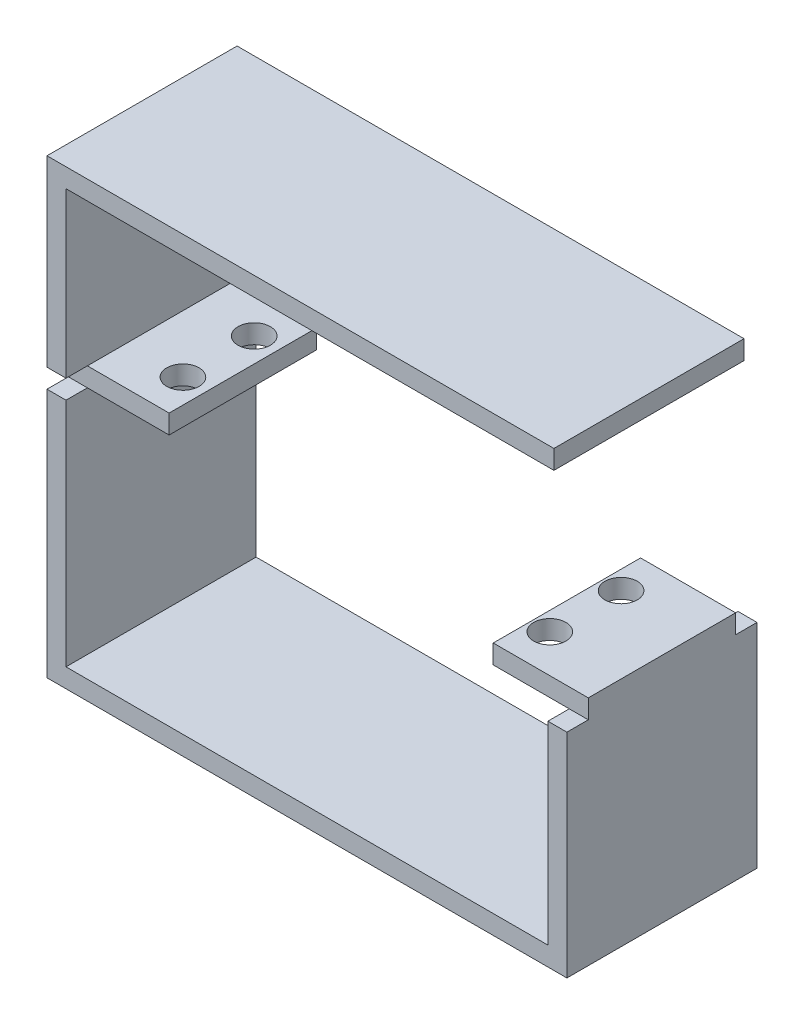
from build123d import *

# Parameters (mm, degrees)
BOSS_EXTRUDE1_OUTLINE_W = 13.462
BOSS_EXTRUDE1_OUTLINE_H = 19.685
BOSS_EXTRUDE1_OUTLINE_R = 2.159
BOSS_EXTRUDE1_DEPTH     = 2.54
SKETCH2_W               = 12.7
SKETCH2_H               = 19.685
SKETCH2_R               = 2.159
BOSS_EXTRUDE2_DEPTH     = 2.54
BOSS_EXTRUDE3_DEPTH     = 12.7
SKETCH4_R               = 1.9685
BOSS_EXTRUDE4_DEPTH     = 1.524


# Read off the part's stored shape, not the designer's step: Boss-Extrude1
with BuildPart() as part:
    # Boss-Extrude1 outline → Boss-Extrude1 (new body)
    with BuildSketch(Plane(origin=(0, 2.413, 0), x_dir=(1, 0, 0), z_dir=(0, 1, 0))):
        with Locations((-28.0035, 0)):
            Rectangle(BOSS_EXTRUDE1_OUTLINE_W, BOSS_EXTRUDE1_OUTLINE_H)
        with Locations((-24.511, -4.7625)):
            Circle(BOSS_EXTRUDE1_OUTLINE_R, mode=Mode.SUBTRACT)
        with Locations((-24.511, 4.7625)):
            Circle(BOSS_EXTRUDE1_OUTLINE_R, mode=Mode.SUBTRACT)
    extrude(amount=BOSS_EXTRUDE1_DEPTH)



with BuildPart() as body_2:
    # Sketch2 → Boss-Extrude2 (new body)
    with BuildSketch(Plane.XZ):
        with Locations((28.3845, 0)):
            Rectangle(SKETCH2_W, SKETCH2_H)
        with Locations(Location((24.511, 4.7625, 0), (0, 0, 270))):
            Circle(SKETCH2_R, mode=Mode.SUBTRACT)
        with Locations(Location((24.511, -4.7625, 0), (0, 0, 270))):
            Circle(SKETCH2_R, mode=Mode.SUBTRACT)
    extrude(amount=BOSS_EXTRUDE2_DEPTH)


with BuildPart() as part_1:
    add(part.part)

    add(body_2.part)  # Boss-Extrude3 merges body 2
    # Sketch3 → Boss-Extrude3 (add, symmetric)
    with BuildSketch(Plane.XY):
        Polygon((34.7345, -2.54), (34.7345, -30.988), (-34.7345, -30.988), (-34.7345, 2.413), (-32.1945, 2.413), (-32.1945, -28.448), (32.1945, -28.448), (32.1945, -2.54), align=None)
        Polygon((-32.1945, 4.953), (-32.1945, 26.884), (33.000418385, 26.884), (33.000418385, 29.424), (-34.7345, 29.424), (-34.7345, 4.953), align=None)
    extrude(amount=BOSS_EXTRUDE3_DEPTH, both=True)

    # Sketch4 → Boss-Extrude4 (add)
    with BuildSketch(Plane.XZ.offset(-26.884)):
        with Locations(Location((2.921, -8.382, 0), (0, 0, 90))):
            Circle(SKETCH4_R)
        with Locations(Location((19.685, -8.382, 0), (0, 0, 90))):
            Circle(SKETCH4_R)
        with Locations(Location((19.685, 8.382, 0), (0, 0, 90))):
            Circle(SKETCH4_R)
        with Locations(Location((2.921, 8.382, 0), (0, 0, 90))):
            Circle(SKETCH4_R)
    extrude(amount=BOSS_EXTRUDE4_DEPTH)


solid = part_1.part
